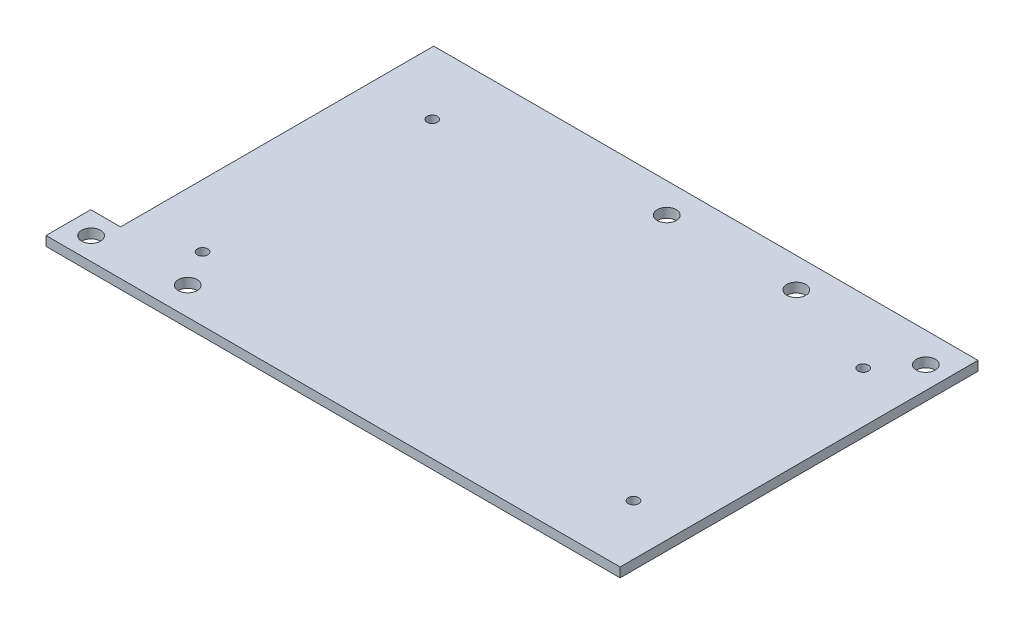
from build123d import *

# Parameters (mm, degrees)
SKETCH1_R           = 6.35
SKETCH1_R_2         = 3.5
BOSS_EXTRUDE1_DEPTH = 6.35


with BuildPart() as part:
    # Sketch1 → Boss-Extrude1 (new body)
    with BuildSketch(Plane(origin=(0, 0, 0), x_dir=(1, 0, 0), z_dir=(0, 1, 0))):
        Polygon((0, 0), (365, 0), (365, -240), (-20, -240), (-20, -210), (0, -210), align=None)
        with Locations((-4.753698984, -225)):
            Circle(SKETCH1_R, mode=Mode.SUBTRACT)
        with Locations((56.333724219, -221.289646053)):
            Circle(SKETCH1_R, mode=Mode.SUBTRACT)
        with Locations((42, -43)):
            Circle(SKETCH1_R_2, mode=Mode.SUBTRACT)
        with Locations((42, -197)):
            Circle(SKETCH1_R_2, mode=Mode.SUBTRACT)
        with Locations((331, -197)):
            Circle(SKETCH1_R_2, mode=Mode.SUBTRACT)
        with Locations((331, -43)):
            Circle(SKETCH1_R_2, mode=Mode.SUBTRACT)
        with Locations((263.133334245, -20)):
            Circle(SKETCH1_R, mode=Mode.SUBTRACT)
        with Locations((176.266668491, -20)):
            Circle(SKETCH1_R, mode=Mode.SUBTRACT)
        with Locations((350, -20)):
            Circle(SKETCH1_R, mode=Mode.SUBTRACT)
    extrude(amount=-BOSS_EXTRUDE1_DEPTH)


solid = part.part
